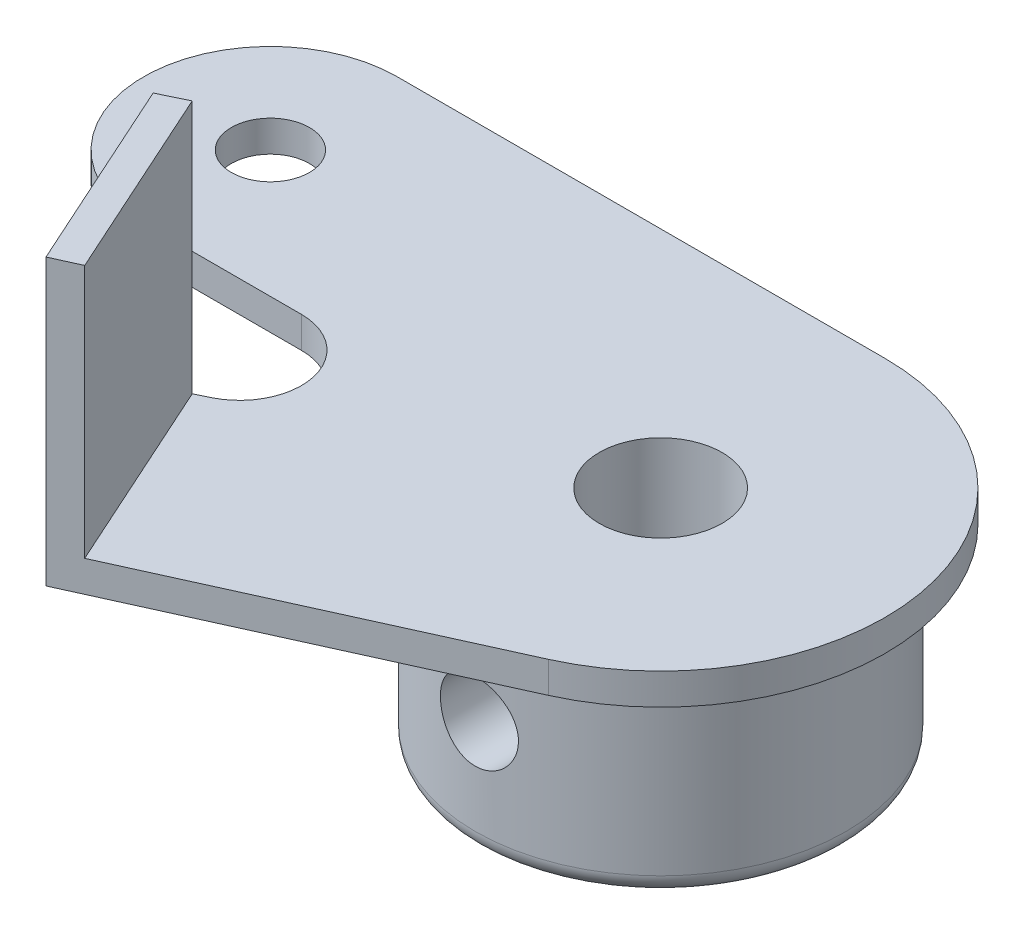
from build123d import *

# Parameters (mm, degrees)
ESQUISSE1_R             = 3.15
ESQUISSE1_R_2           = 2
BOSS_EXTRU_1_DEPTH      = 1.6
BOSS_EXTRU_2_START      = -11.5
ESQUISSE2_R             = 9.5
ESQUISSE2_R_2           = 3.15
BOSS_EXTRU_2_DEPTH      = 11.5
CONG_1_R                = 1
BOSS_EXTRU_3_DEPTH      = 13
ESQUISSE4_R             = 2
ENL_V_MAT_EXTRU_1_DEPTH = 40.340310116


with BuildPart() as part:
    # Esquisse1 → Boss.-Extru.1 (new body)
    with BuildSketch(Plane(origin=(0, 0, 0), x_dir=(1, 0, 0), z_dir=(0, 1, 0))):
        with BuildLine():
            Line((0, 11.5), (-25, 11.5))
            ThreePointArc((-25, 11.5), (-31.5, 5), (-25, -1.5))
            Line((-25, -1.5), (-16.90921754, -1.5))
            ThreePointArc((-16.90921754, -1.5), (-13.826301978, -3.956560509), (-15.532463951, -7.510159982))
            Line((-15.532463951, -7.510159982), (-17.532463951, -8.477187494))
            Line((-17.532463951, -8.477187494), (-13, -18.5))
            Line((-13, -18.5), (4.73848504, -10.478394893))
            ThreePointArc((4.73848504, -10.478394893), (11.241697854, 2.423680954), (0, 11.5))
        make_face()
        Circle(ESQUISSE1_R, mode=Mode.SUBTRACT)
        with Locations((-25, 5)):
            Circle(ESQUISSE1_R_2, mode=Mode.SUBTRACT)
    extrude(amount=BOSS_EXTRU_1_DEPTH)

    # Esquisse2 → Boss.-Extru.2 (add)
    with BuildSketch(Plane(origin=(0, 1.6, 0), x_dir=(1, 0, 0), z_dir=(0, 1, 0)).offset(BOSS_EXTRU_2_START)):
        Circle(ESQUISSE2_R)
        Circle(ESQUISSE2_R_2, mode=Mode.SUBTRACT)
    extrude(amount=BOSS_EXTRU_2_DEPTH)

    # Congé1
    cong_1_edges = [part.edges().sort_by_distance(p)[0] for p in [
        (-9.5, -9.9, 0),
    ]]
    fillet(cong_1_edges, radius=CONG_1_R)

    # Esquisse3 → Boss.-Extru.3 (add)
    with BuildSketch(Plane(origin=(0, 1.6, 0), x_dir=(1, 0, 0), z_dir=(0, 1, 0))):
        Polygon((-17.532463951, -8.477187494), (-13, -18.5), (-11.633703391, -17.88214048), (-16.182035998, -7.824237002), align=None)
    extrude(amount=BOSS_EXTRU_3_DEPTH)

    # Esquisse4 → Enlèv. mat.-Extru.1 (cut, through all)
    with BuildSketch(Plane.XY):
        with Locations((0, -4)):
            Circle(ESQUISSE4_R)
    extrude(amount=ENL_V_MAT_EXTRU_1_DEPTH, mode=Mode.SUBTRACT)


solid = part.part
